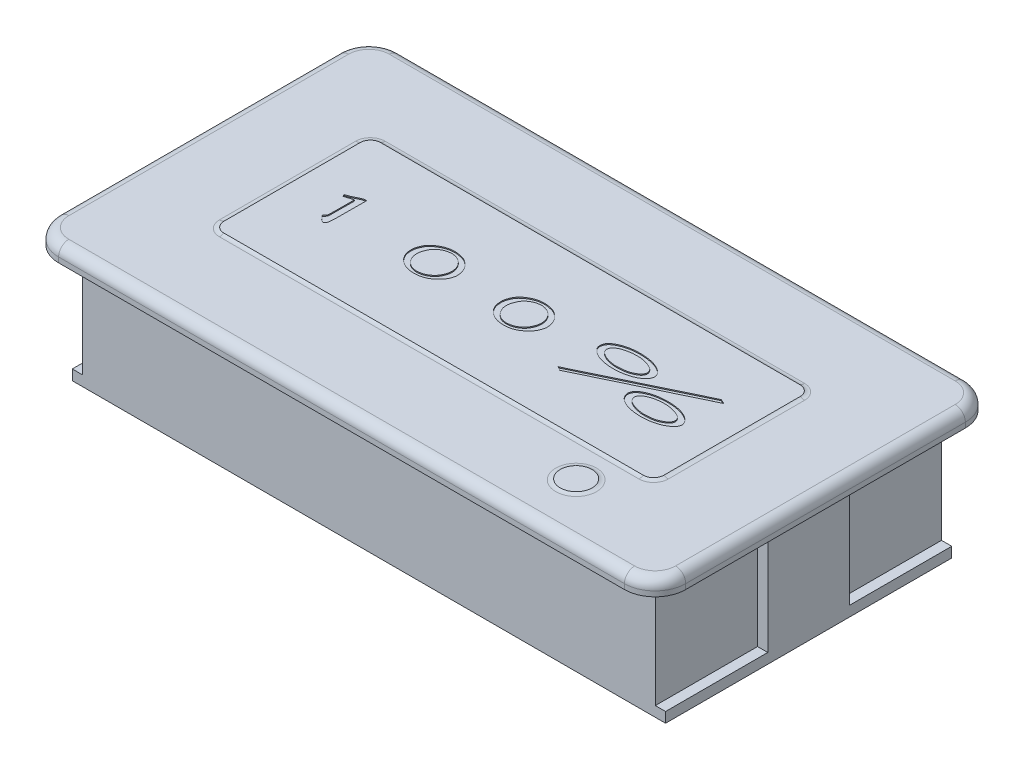
from build123d import *

# Parameters (mm, degrees)
SKETCH_1_W          = 61.36
SKETCH_1_H          = 33.36
EXTRUDE_1_DEPTH     = 1.5
SKETCH_2_W          = 58.05
SKETCH_2_H          = 28
EXTRUDE_2_DEPTH     = 12
CUT_EXTRUDE_1_REACH = 47.017
SKETCH_3_W          = 1
SKETCH_3_H          = 11
SKETCH_6_W          = 8
SKETCH_6_H          = 3
CUT_EXTRUDE_2_DEPTH = 0.1
SKETCH_8_R          = 1.561705839
SKETCH_8_W          = 43.044921596
SKETCH_8_H          = 15.335355584
EXTRUDE_5_DEPTH     = 0.1
FILLET_1_R          = 3
FILLET_2_R          = 1
FILLET_3_R          = 1
CUT_EXTRUDE_3_DEPTH = 0.1
SKETCH_10_R         = 0.5
EXTRUDE_6_DEPTH     = 0.1
SKETCH_5_W          = 1
SKETCH_5_H          = 11
EXTRUDE_4_DEPTH     = 4


with BuildPart() as part:
    # 草图1 → 凸台-拉伸1 (new body)
    with BuildSketch(Plane(origin=(0, 0, 0), x_dir=(1, 0, 0), z_dir=(0, 1, 0))):
        Rectangle(SKETCH_1_W, SKETCH_1_H)
    extrude(amount=EXTRUDE_1_DEPTH)

    # 草图2 → 凸台-拉伸2 (add)
    with BuildSketch(Plane.XZ):
        Rectangle(SKETCH_2_W, SKETCH_2_H)
    extrude(amount=EXTRUDE_2_DEPTH)

    # 草图3 → 切除-拉伸1 (cut, up to next)
    with BuildSketch(Plane.XY.offset(14), mode=Mode.PRIVATE) as cut_extrude_1_sk1:
        with Locations((-28.525, -5.5)):
            Rectangle(SKETCH_3_W, SKETCH_3_H)
    cut_extrude_1_tool1 = extrude(cut_extrude_1_sk1.sketch, amount=-CUT_EXTRUDE_1_REACH, mode=Mode.PRIVATE) & part.part
    # 草图3 → 切除-拉伸1 (cut, up to next)
    with BuildSketch(Plane.XY.offset(14), mode=Mode.PRIVATE) as cut_extrude_1_sk2:
        with Locations((28.525, -5.5)):
            Rectangle(SKETCH_3_W, SKETCH_3_H)
    cut_extrude_1_tool2 = extrude(cut_extrude_1_sk2.sketch, amount=-CUT_EXTRUDE_1_REACH, mode=Mode.PRIVATE) & part.part
    add(cut_extrude_1_tool1.solids().sort_by_distance((-28.525, -5.5, 14))[0], mode=Mode.SUBTRACT)
    add(cut_extrude_1_tool2.solids().sort_by_distance((28.525, -5.5, 14))[0], mode=Mode.SUBTRACT)

    # 草图6 → 切除-拉伸2 (cut)
    with BuildSketch(Plane.XZ.offset(12)):
        with Locations((-20.025, 10.5)):
            Rectangle(SKETCH_6_W, SKETCH_6_H)
    extrude(amount=-CUT_EXTRUDE_2_DEPTH, mode=Mode.SUBTRACT)

    # 草图8 → 凸台-拉伸5 (add)
    with BuildSketch(Plane(origin=(0, 1.5, 0), x_dir=(1, 0, 0), z_dir=(0, 1, 0))):
        with Locations(Location((17.525272803, -11.248179316, 0), (0, 0, 270))):
            Circle(SKETCH_8_R)
        Rectangle(SKETCH_8_W, SKETCH_8_H)
    extrude(amount=EXTRUDE_5_DEPTH)

    # 圆角1
    fillet_1_edges = [part.edges().sort_by_distance(p)[0] for p in [
        (-30.68, 0.75, -16.68),
        (30.68, 0.75, -16.68),
        (30.68, 0.75, 16.68),
        (-30.68, 0.75, 16.68),
    ]]
    fillet(fillet_1_edges, radius=FILLET_1_R)

    # 圆角2
    fillet_2_edges = [part.edges().sort_by_distance(p)[0] for p in [
        (-21.522460798, 1.55, -7.667677792),
        (-21.522460798, 1.55, 7.667677792),
        (21.522460798, 1.55, 7.667677792),
        (21.522460798, 1.55, -7.667677792),
    ]]
    fillet(fillet_2_edges, radius=FILLET_2_R)

    # 圆角3
    # the kernel refuses this fillet: 1 mm, written as the material it adds along each edge
    with BuildSketch(Plane(origin=(20.522460798, 1.5, 6.667677792), x_dir=(0, 0, 1), z_dir=(-1, 0, 0))) as fillet_3_piece_1:
        with BuildLine():
            CenterArc((1.435889894, 1), FILLET_3_R, 244.158067237, 25.841932763)
            Line((1, 0.1), (1, 0))
            Line((1, 0), (1.435889894, 0))
        make_face()
    revolve(axis=Axis((20.522460798, 1.5, 6.667677792), (0, 1, 0)), revolution_arc=90)
    with BuildSketch(Plane(origin=(21.522460798, 1.5, -6.667677792), x_dir=(1, 0, 0), z_dir=(0, 0, 1)), Plane(origin=(-21.522460798, 1.5, 6.667677792), x_dir=(-1, 0, 0), z_dir=(0, 0, -1))) as fillet_3_piece_2:
        with BuildLine():
            CenterArc((0.435889894, 1), FILLET_3_R, 244.158067237, 25.841932763)
            Line((0, 0.1), (0, 0))
            Line((0, 0), (0.435889894, 0))
        make_face()
    extrude(amount=13.335355584)
    with BuildSketch(Plane(origin=(20.522460798, 1.5, -6.667677792), x_dir=(0, 0, -1), z_dir=(-1, 0, 0))) as fillet_3_piece_3:
        with BuildLine():
            CenterArc((1.435889894, -1), FILLET_3_R, 90, 25.841932763)
            Line((1, -0.1), (1, 0))
            Line((1, 0), (1.435889894, 0))
        make_face()
    revolve(axis=Axis((20.522460798, 1.5, -6.667677792), (0, -1, 0)), revolution_arc=90)
    with BuildSketch(Plane(origin=(-20.522460798, 1.5, -7.667677792), x_dir=(0, 0, -1), z_dir=(1, 0, 0)), Plane(origin=(20.522460798, 1.5, 7.667677792), x_dir=(0, 0, 1), z_dir=(-1, 0, 0))) as fillet_3_piece_4:
        with BuildLine():
            CenterArc((0.435889894, 1), FILLET_3_R, 244.158067237, 25.841932763)
            Line((0, 0.1), (0, 0))
            Line((0, 0), (0.435889894, 0))
        make_face()
    extrude(amount=41.044921596)
    with BuildSketch(Plane(origin=(-20.522460798, 1.5, -6.667677792), x_dir=(-1, 0, 0), z_dir=(0, 0, 1))) as fillet_3_piece_5:
        with BuildLine():
            CenterArc((1.435889894, -1), FILLET_3_R, 90, 25.841932763)
            Line((1, -0.1), (1, 0))
            Line((1, 0), (1.435889894, 0))
        make_face()
    revolve(axis=Axis((-20.522460798, 1.5, -6.667677792), (0, -1, 0)), revolution_arc=90)
    with BuildSketch(Plane(origin=(-20.522460798, 1.5, 6.667677792), x_dir=(0, 0, 1), z_dir=(1, 0, 0))) as fillet_3_piece_6:
        with BuildLine():
            CenterArc((1.435889894, -1), FILLET_3_R, 90, 25.841932763)
            Line((1, -0.1), (1, 0))
            Line((1, 0), (1.435889894, 0))
        make_face()
    revolve(axis=Axis((-20.522460798, 1.5, 6.667677792), (0, -1, 0)), revolution_arc=90)
    with BuildSketch(Plane(origin=(17.525272803, 1.5, 11.248179316), x_dir=(0, 0, 1), z_dir=(-1, 0, 0))) as fillet_3_piece_7:
        with BuildLine():
            CenterArc((1.997595733, 1), FILLET_3_R, 244.158067237, 25.841932763)
            Line((1.561705839, 0.1), (1.561705839, 0))
            Line((1.561705839, 0), (1.997595733, 0))
        make_face()
    revolve(axis=Axis((17.525272803, 1.5, 11.248179316), (0, 1, 0)))
    # the kernel refuses this fillet: 1 mm, written as the material it takes off along each edge
    with BuildSketch(Plane(origin=(-27.68, 1.5, -13.68), x_dir=(-1, 0, 0), z_dir=(0, 0, 1))) as fillet_3_2_piece_1:
        with BuildLine():
            CenterArc((3 - FILLET_3_R, FILLET_3_R), FILLET_3_R, 270, 90)
            Line((3, FILLET_3_R), (3, 0))
            Line((3, 0), (3 - FILLET_3_R, 0))
        make_face()
    revolve(axis=Axis((-27.68, 1.5, -13.68), (0, -1, 0)), revolution_arc=90, mode=Mode.SUBTRACT)
    with BuildSketch(Plane(origin=(-27.68, 1.5, -16.68), x_dir=(0, 0, 1), z_dir=(1, 0, 0)), Plane(origin=(27.68, 1.5, 16.68), x_dir=(0, 0, -1), z_dir=(-1, 0, 0))) as fillet_3_2_piece_2:
        with BuildLine():
            CenterArc((FILLET_3_R, FILLET_3_R), FILLET_3_R, 180, 90)
            Line((0, FILLET_3_R), (0, 0))
            Line((0, 0), (FILLET_3_R, 0))
        make_face()
    extrude(amount=55.36, mode=Mode.SUBTRACT)
    with BuildSketch(Plane(origin=(27.68, 1.5, -13.68), x_dir=(1, 0, 0), z_dir=(0, 0, 1))) as fillet_3_2_piece_3:
        with BuildLine():
            CenterArc((3 - FILLET_3_R, -FILLET_3_R), FILLET_3_R, 0, 90)
            Line((3, -FILLET_3_R), (3, 0))
            Line((3, 0), (3 - FILLET_3_R, 0))
        make_face()
    revolve(axis=Axis((27.68, 1.5, -13.68), (0, 1, 0)), revolution_arc=90, mode=Mode.SUBTRACT)
    with BuildSketch(Plane(origin=(30.68, 1.5, -13.68), x_dir=(-1, 0, 0), z_dir=(0, 0, 1)), Plane(origin=(-30.68, 1.5, 13.68), x_dir=(1, 0, 0), z_dir=(0, 0, -1))) as fillet_3_2_piece_4:
        with BuildLine():
            CenterArc((FILLET_3_R, FILLET_3_R), FILLET_3_R, 180, 90)
            Line((0, FILLET_3_R), (0, 0))
            Line((0, 0), (FILLET_3_R, 0))
        make_face()
    extrude(amount=27.36, mode=Mode.SUBTRACT)
    with BuildSketch(Plane(origin=(27.68, 1.5, 13.68), x_dir=(0, 0, 1), z_dir=(-1, 0, 0))) as fillet_3_2_piece_5:
        with BuildLine():
            CenterArc((3 - FILLET_3_R, -FILLET_3_R), FILLET_3_R, 0, 90)
            Line((3, -FILLET_3_R), (3, 0))
            Line((3, 0), (3 - FILLET_3_R, 0))
        make_face()
    revolve(axis=Axis((27.68, 1.5, 13.68), (0, 1, 0)), revolution_arc=90, mode=Mode.SUBTRACT)
    with BuildSketch(Plane(origin=(-27.68, 1.5, 13.68), x_dir=(0, 0, 1), z_dir=(1, 0, 0))) as fillet_3_2_piece_6:
        with BuildLine():
            CenterArc((3 - FILLET_3_R, FILLET_3_R), FILLET_3_R, 270, 90)
            Line((3, FILLET_3_R), (3, 0))
            Line((3, 0), (3 - FILLET_3_R, 0))
        make_face()
    revolve(axis=Axis((-27.68, 1.5, 13.68), (0, -1, 0)), revolution_arc=90, mode=Mode.SUBTRACT)

    # 草图9 → 切除-拉伸3 (cut)
    # profile 1 of 6: a face of its own
    with BuildSketch(Plane(origin=(0, 1.6, 0), x_dir=(1, 0, 0), z_dir=(0, 1, 0))):
        with BuildLine():
            Line((-16.522305337, 2.04982507), (-16.278005857, 2.077845082))
            Line((-16.278005857, 2.077845082), (-16.295518364, -1.020993128))
            add(Edge.make_bspline(
                [(-16.295518364, -1.020993128), (-16.29694041, -1.052517439), (-16.29963999, -1.112362505), (-16.304075821, -1.197880181), (-16.308384257, -1.274648769), (-16.312747498, -1.342950587), (-16.317011922, -1.402213625), (-16.321434023, -1.452710411), (-16.325674854, -1.494469232), (-16.334037704, -1.560231768), (-16.357379973, -1.655919386), (-16.391977046, -1.760161813), (-16.437180737, -1.840070294), (-16.493518355, -1.880949742), (-16.564478291, -1.901487995), (-16.615587949, -1.898324159), (-16.643141639, -1.896618506)],
                knots=[0, 0, 0, 0, 1.253270449, 2.379181433, 3.400917398, 4.306944487, 5.097324398, 5.760602192, 6.320025896, 6.764316387, 8.392561048, 10.218797506, 11.125639935, 11.97880986, 12.910357651, 14, 14, 14, 14], degree=3))
            add(Edge.make_bspline(
                [(-16.643141639, -1.896618506), (-16.644310129, -1.896330377), (-16.64870988, -1.895245479), (-16.658582245, -1.892426592), (-16.674967288, -1.888176091), (-16.705992852, -1.880509313), (-16.749773069, -1.860721411), (-16.776820819, -1.832080494), (-16.791122328, -1.816936596)],
                knots=[0, 0, 0, 0, 0.126258631, 0.475405613, 1.0770367, 1.901565101, 3.832950775, 6, 6, 6, 6], degree=3))
            Line((-16.791122328, -1.816936596), (-16.872555488, -1.74425969))
            Line((-16.872555488, -1.74425969), (-17.064317446, -1.533233974))
            add(Edge.make_bspline(
                [(-17.064317446, -1.533233974), (-17.077546765, -1.519601763), (-17.10229149, -1.494103451), (-17.135458436, -1.457232954), (-17.163159985, -1.425389386), (-17.182953382, -1.396492648), (-17.199567176, -1.373688666), (-17.208651575, -1.353985237), (-17.213037604, -1.337700687), (-17.203646567, -1.314165557), (-17.176473622, -1.288950612), (-17.141160488, -1.251308257), (-17.099935265, -1.211376664), (-17.060920712, -1.163758839), (-17.024866908, -1.113955426), (-16.996751892, -1.059862421), (-16.976204755, -0.998705059), (-16.968303048, -0.938326854), (-16.96409758, -0.879191788), (-16.961313097, -0.82254669), (-16.961076321, -0.755384535), (-16.960453804, -0.707226405), (-16.960118026, -0.681250482)],
                knots=[0, 0, 0, 0, 1.159192629, 2.168207027, 3.028127215, 3.730173768, 4.308262321, 4.738775655, 5.063864675, 5.289205653, 6.238082505, 7.283704709, 8.45528819, 9.73262076, 11.037362537, 12.200654645, 13.440030025, 14.954285351, 15.901153286, 17.060345915, 18.414385521, 20, 20, 20, 20], degree=3))
            Line((-16.960118026, -0.681250482), (-16.942605518, 1.536708599))
            Line((-16.942605518, 1.536708599), (-17.797215886, 1.274896611))
            Line((-17.797215886, 1.274896611), (-17.900539681, 1.457902315))
            add(Edge.make_bspline(
                [(-17.900539681, 1.457902315), (-17.860535442, 1.473034217), (-17.78336935, 1.502222867), (-17.672768707, 1.544895091), (-17.571870932, 1.584530674), (-17.480585635, 1.620175418), (-17.398931455, 1.653640746), (-17.326814563, 1.683953197), (-17.264410694, 1.711241173), (-17.160022952, 1.758032752), (-17.00976662, 1.832929545), (-16.879600057, 1.904589605), (-16.813012962, 1.941247523)],
                knots=[0, 0, 0, 0, 1.076823803, 2.077136992, 2.984608936, 3.806096834, 4.544355276, 5.206290949, 5.77559763, 6.259092731, 8.086327693, 10, 10, 10, 10], degree=3))
            Line((-16.813012962, 1.941247523), (-16.537190968, 2.045446943))
            Line((-16.537190968, 2.045446943), (-16.522305337, 2.04982507))
        make_face()
    # profile 2 of 6: a face of its own
    with BuildSketch(Plane(origin=(0, 1.6, 0), x_dir=(1, 0, 0), z_dir=(0, 1, 0))):
        with BuildLine():
            add(Edge.make_bspline(
                [(-9.946008503, 0.217141155), (-9.93814979, 0.274284489), (-9.921853486, 0.392780372), (-9.872565759, 0.572793753), (-9.804495018, 0.760965555), (-9.733972285, 0.921824268), (-9.666465664, 1.051878332), (-9.604191043, 1.146900063), (-9.534118965, 1.238647777), (-9.456267266, 1.327601742), (-9.368645206, 1.411399982), (-9.274138711, 1.493288235), (-9.170448865, 1.571188671), (-9.05970556, 1.644306183), (-8.946222973, 1.711959765), (-8.835621694, 1.775656145), (-8.727339239, 1.830475228), (-8.623193933, 1.880157755), (-8.521716135, 1.922078976), (-8.423575741, 1.957285346), (-8.328924755, 1.985672556), (-8.208308076, 2.012858602), (-8.063117878, 2.037425577), (-7.89457868, 2.058843671), (-7.733489018, 2.070985514), (-7.628538173, 2.0708877), (-7.577441857, 2.070840079)],
                knots=[0, 0, 0, 0, 1.254515551, 2.601439504, 4.052433186, 5.608449262, 6.42134114, 7.239060577, 8.077763398, 8.933075807, 9.809254552, 10.714796857, 11.653866356, 12.63011514, 13.602074704, 14.529638956, 15.407681693, 16.243298377, 17.040925322, 17.79655296, 18.512231994, 19.190375642, 20.486671252, 21.716061122, 22.888042678, 24, 24, 24, 24], degree=3))
            add(Edge.make_bspline(
                [(-7.577441857, 2.070840079), (-7.526605438, 2.06761165), (-7.421706275, 2.0609499), (-7.260596316, 2.039484296), (-7.09132992, 2.007167209), (-6.915906333, 1.967574333), (-6.740474671, 1.915233063), (-6.573214799, 1.843687704), (-6.416140384, 1.756000594), (-6.272349437, 1.651198449), (-6.14029858, 1.539393943), (-6.020394422, 1.425331468), (-5.914682482, 1.309944612), (-5.823738484, 1.191311809), (-5.744134881, 1.06919672), (-5.67794438, 0.939744157), (-5.621444476, 0.803753027), (-5.577344166, 0.661357668), (-5.544448385, 0.516475524), (-5.517645226, 0.372077335), (-5.504166428, 0.228783787), (-5.501685145, 0.133686571), (-5.500458462, 0.086672974)],
                knots=[0, 0, 0, 0, 0.953788111, 1.968108232, 3.041301502, 4.180314873, 5.335349277, 6.464389544, 7.580426586, 8.696905307, 9.790849521, 10.819270693, 11.794420408, 12.718290759, 13.615914081, 14.520500969, 15.437163111, 16.370765878, 17.308201447, 18.21858344, 19.119313855, 20, 20, 20, 20], degree=3))
            add(Edge.make_bspline(
                [(-5.500458462, 0.086672974), (-5.506974277, 0.0483369), (-5.520289402, -0.030003198), (-5.550086524, -0.148130652), (-5.585823037, -0.270500374), (-5.630374589, -0.396601969), (-5.685931575, -0.527050662), (-5.76069511, -0.657846716), (-5.850235186, -0.791758416), (-5.95708489, -0.925325077), (-6.077517821, -1.058295048), (-6.214885491, -1.184254879), (-6.364275809, -1.306593656), (-6.527460778, -1.419598865), (-6.698855053, -1.522570474), (-6.87866159, -1.605818911), (-7.063277859, -1.671388487), (-7.251219621, -1.716297508), (-7.436078535, -1.747134302), (-7.613535283, -1.766994658), (-7.781307538, -1.779076701), (-7.890024947, -1.776855773), (-7.94257764, -1.775782204)],
                knots=[0, 0, 0, 0, 0.693567351, 1.417310842, 2.172018723, 2.9675753, 3.802519327, 4.697825103, 5.651110217, 6.674267052, 7.746920624, 8.848709664, 9.996326313, 11.189624248, 12.387323168, 13.559247832, 14.718783999, 15.877021346, 17.001999769, 18.060758541, 19.062593923, 20, 20, 20, 20], degree=3))
            add(Edge.make_bspline(
                [(-7.94257764, -1.775782204), (-7.99051375, -1.773964685), (-8.089963576, -1.770194002), (-8.242936165, -1.748122315), (-8.40537584, -1.718939345), (-8.5746364, -1.677637579), (-8.746215737, -1.621491775), (-8.915148468, -1.548156721), (-9.077412061, -1.454969812), (-9.23297447, -1.347535266), (-9.377410583, -1.226658991), (-9.50687634, -1.096199536), (-9.621472082, -0.958741916), (-9.717479005, -0.814300102), (-9.796552051, -0.668742935), (-9.857886883, -0.526452517), (-9.900233798, -0.388753243), (-9.922251848, -0.255465319), (-9.931942176, -0.128521372), (-9.94043468, -0.007988853), (-9.944670162, 0.106490169), (-9.945570719, 0.180946203), (-9.946008503, 0.217141155)],
                knots=[0, 0, 0, 0, 0.905667355, 1.878927178, 2.916113879, 4.023452927, 5.16732576, 6.322913841, 7.495868378, 8.696580582, 9.89043616, 11.048455469, 12.16465534, 13.265771476, 14.319304284, 15.290233916, 16.188620489, 17.033496907, 17.836243281, 18.593298513, 19.316166999, 20, 20, 20, 20], degree=3))
        make_face()
        with BuildLine():
            add(Edge.make_bspline(
                [(-9.33482199, 0.192623645), (-9.336853692, 0.165494856), (-9.341174595, 0.107798952), (-9.341997306, 0.015370775), (-9.335675863, -0.087677224), (-9.327403895, -0.200166619), (-9.308951871, -0.318775297), (-9.274979838, -0.438908692), (-9.228247779, -0.559340595), (-9.168713672, -0.678888863), (-9.097329344, -0.795571186), (-9.014461599, -0.907301904), (-8.921179375, -1.01314091), (-8.81997267, -1.113404366), (-8.711151214, -1.203067897), (-8.596101231, -1.278006827), (-8.477750733, -1.339597392), (-8.355176718, -1.383034741), (-8.234726498, -1.414649782), (-8.119214776, -1.437727444), (-8.009793811, -1.452501136), (-7.938532658, -1.454979626), (-7.904050123, -1.456178941)],
                knots=[0, 0, 0, 0, 0.664039602, 1.412240222, 2.254123296, 3.183735048, 4.165386184, 5.1784212, 6.225102978, 7.314916093, 8.434306671, 9.560141952, 10.706356806, 11.875312884, 13.034915157, 14.141647827, 15.221938858, 16.283623018, 17.308541476, 18.260175532, 19.158116925, 20, 20, 20, 20], degree=3))
            add(Edge.make_bspline(
                [(-7.904050123, -1.456178941), (-7.869883566, -1.456071333), (-7.798205919, -1.455845583), (-7.685551259, -1.445577591), (-7.562969676, -1.426452822), (-7.430881137, -1.401322977), (-7.293274056, -1.3638224), (-7.155483404, -1.308590611), (-7.017997933, -1.238955604), (-6.884058951, -1.155000782), (-6.757422565, -1.062419286), (-6.644106849, -0.964263348), (-6.545475255, -0.863177223), (-6.462931988, -0.757310113), (-6.39285333, -0.647809512), (-6.329394134, -0.537585044), (-6.276030701, -0.423262835), (-6.229804969, -0.308166868), (-6.192665734, -0.192961128), (-6.162772551, -0.081680588), (-6.141129483, 0.025311963), (-6.128723757, 0.129839999), (-6.124025667, 0.236702623), (-6.129221118, 0.349608402), (-6.141147473, 0.471040887), (-6.155731355, 0.554046012), (-6.163306873, 0.597162569)],
                knots=[0, 0, 0, 0, 0.796315816, 1.670582245, 2.633958042, 3.688291156, 4.804414464, 5.953110511, 7.143073555, 8.393162038, 9.634477078, 10.797038444, 11.884709299, 12.922038782, 13.920538545, 14.914016718, 15.885077141, 16.859375076, 17.804111584, 18.70537311, 19.544834175, 20.346713433, 21.157237687, 22.035757835, 22.979685189, 24, 24, 24, 24], degree=3))
            add(Edge.make_bspline(
                [(-6.163306873, 0.597162569), (-6.174578836, 0.638249654), (-6.196585587, 0.718465782), (-6.2405171, 0.832350653), (-6.288053909, 0.939191776), (-6.344080336, 1.038330512), (-6.408593171, 1.133367739), (-6.483613012, 1.22562003), (-6.570768375, 1.316084628), (-6.666179873, 1.405713021), (-6.771854551, 1.488592665), (-6.886796779, 1.559819787), (-7.00849922, 1.620003707), (-7.13617532, 1.664724987), (-7.2623368, 1.699603184), (-7.381638857, 1.727451306), (-7.492929259, 1.744666597), (-7.564260055, 1.7491077), (-7.598456866, 1.751236816)],
                knots=[0, 0, 0, 0, 1.032713607, 2.016212303, 2.957132945, 3.866830179, 4.773962121, 5.740265773, 6.746732151, 7.818710245, 8.913333296, 9.997652484, 11.093099316, 12.19931275, 13.272855827, 14.267224483, 15.169287294, 16, 16, 16, 16], degree=3))
            add(Edge.make_bspline(
                [(-7.598456866, 1.751236816), (-7.633802776, 1.75057827), (-7.707292196, 1.749209055), (-7.821237431, 1.736788544), (-7.9433941, 1.718333672), (-8.073974801, 1.692593757), (-8.213275, 1.654352196), (-8.357172444, 1.590461941), (-8.509129847, 1.509188299), (-8.636567883, 1.424763017), (-8.73899657, 1.348878697), (-8.81172595, 1.285218631), (-8.880304753, 1.21832198), (-8.942529414, 1.14571333), (-9.000266819, 1.069779441), (-9.053364957, 0.989590355), (-9.100596005, 0.904603472), (-9.154571396, 0.787740955), (-9.212298699, 0.645532318), (-9.269088807, 0.483234925), (-9.31073282, 0.334119473), (-9.327093268, 0.238020889), (-9.33482199, 0.192623645)],
                knots=[0, 0, 0, 0, 0.827660369, 1.720829398, 2.681877364, 3.720947843, 4.837486309, 6.056520426, 7.399283751, 8.870690157, 9.632270116, 10.383438355, 11.132737703, 11.874262335, 12.620812181, 13.365983471, 14.124950798, 14.895620383, 16.379693499, 17.71797672, 18.921965695, 20, 20, 20, 20], degree=3))
        make_face(mode=Mode.SUBTRACT)
    # profile 3 of 6: a face of its own
    with BuildSketch(Plane(origin=(0, 1.6, 0), x_dir=(1, 0, 0), z_dir=(0, 1, 0))):
        with BuildLine():
            add(Edge.make_bspline(
                [(-1.170140721, 0.217141155), (-1.162282008, 0.274284489), (-1.145985705, 0.392780372), (-1.096697978, 0.572793753), (-1.028627236, 0.760965555), (-0.958104503, 0.921824268), (-0.890597882, 1.051878332), (-0.828323261, 1.146900063), (-0.758251183, 1.238647777), (-0.680399484, 1.327601742), (-0.592777424, 1.411399982), (-0.498270929, 1.493288235), (-0.394581083, 1.571188671), (-0.283837778, 1.644306183), (-0.170355191, 1.711959765), (-0.059753912, 1.775656145), (0.048528543, 1.830475228), (0.152673849, 1.880157755), (0.254151647, 1.922078976), (0.352292041, 1.957285346), (0.446943027, 1.985672556), (0.567559706, 2.012858602), (0.712749904, 2.037425577), (0.881289102, 2.058843671), (1.042378764, 2.070985514), (1.147329609, 2.0708877), (1.198425924, 2.070840079)],
                knots=[0, 0, 0, 0, 1.254515551, 2.601439504, 4.052433186, 5.608449262, 6.42134114, 7.239060577, 8.077763398, 8.933075807, 9.809254552, 10.714796857, 11.653866356, 12.63011514, 13.602074704, 14.529638956, 15.407681693, 16.243298377, 17.040925322, 17.79655296, 18.512231994, 19.190375642, 20.486671252, 21.716061122, 22.888042678, 24, 24, 24, 24], degree=3))
            add(Edge.make_bspline(
                [(1.198425924, 2.070840079), (1.249262344, 2.06761165), (1.354161507, 2.0609499), (1.515271466, 2.039484296), (1.684537862, 2.007167209), (1.859961449, 1.967574333), (2.03539311, 1.915233063), (2.202652982, 1.843687704), (2.359727397, 1.756000594), (2.503518345, 1.651198449), (2.635569202, 1.539393943), (2.75547336, 1.425331468), (2.8611853, 1.309944612), (2.952129298, 1.191311809), (3.031732901, 1.06919672), (3.097923402, 0.939744157), (3.154423306, 0.803753027), (3.198523616, 0.661357668), (3.231419397, 0.516475524), (3.258222556, 0.372077335), (3.271701354, 0.228783787), (3.274182637, 0.133686571), (3.275409319, 0.086672974)],
                knots=[0, 0, 0, 0, 0.953788111, 1.968108232, 3.041301502, 4.180314873, 5.335349277, 6.464389544, 7.580426586, 8.696905307, 9.790849521, 10.819270693, 11.794420408, 12.718290759, 13.615914081, 14.520500969, 15.437163111, 16.370765878, 17.308201447, 18.21858344, 19.119313855, 20, 20, 20, 20], degree=3))
            add(Edge.make_bspline(
                [(3.275409319, 0.086672974), (3.268893504, 0.0483369), (3.25557838, -0.030003198), (3.225781258, -0.148130652), (3.190044744, -0.270500374), (3.145493193, -0.396601969), (3.089936207, -0.527050662), (3.015172672, -0.657846716), (2.925632596, -0.791758416), (2.818782892, -0.925325077), (2.698349961, -1.058295048), (2.560982291, -1.184254879), (2.411591973, -1.306593656), (2.248407004, -1.419598865), (2.077012729, -1.522570474), (1.897206192, -1.605818911), (1.712589922, -1.671388487), (1.524648161, -1.716297508), (1.339789247, -1.747134302), (1.162332499, -1.766994658), (0.994560244, -1.779076701), (0.885842835, -1.776855773), (0.833290142, -1.775782204)],
                knots=[0, 0, 0, 0, 0.693567351, 1.417310842, 2.172018723, 2.9675753, 3.802519327, 4.697825103, 5.651110217, 6.674267052, 7.746920624, 8.848709664, 9.996326313, 11.189624248, 12.387323168, 13.559247832, 14.718783999, 15.877021346, 17.001999769, 18.060758541, 19.062593923, 20, 20, 20, 20], degree=3))
            add(Edge.make_bspline(
                [(0.833290142, -1.775782204), (0.785354032, -1.773964685), (0.685904206, -1.770194002), (0.532931617, -1.748122315), (0.370491942, -1.718939345), (0.201231382, -1.677637579), (0.029652045, -1.621491775), (-0.139280687, -1.548156721), (-0.30154428, -1.454969812), (-0.457106688, -1.347535266), (-0.601542801, -1.226658991), (-0.731008558, -1.096199536), (-0.8456043, -0.958741916), (-0.941611224, -0.814300102), (-1.020684269, -0.668742935), (-1.082019102, -0.526452517), (-1.124366016, -0.388753243), (-1.146384067, -0.255465319), (-1.156074394, -0.128521372), (-1.164566898, -0.007988853), (-1.16880238, 0.106490169), (-1.169702938, 0.180946203), (-1.170140721, 0.217141155)],
                knots=[0, 0, 0, 0, 0.905667355, 1.878927178, 2.916113879, 4.023452927, 5.16732576, 6.322913841, 7.495868378, 8.696580582, 9.89043616, 11.048455469, 12.16465534, 13.265771476, 14.319304284, 15.290233916, 16.188620489, 17.033496907, 17.836243281, 18.593298513, 19.316166999, 20, 20, 20, 20], degree=3))
        make_face()
        with BuildLine():
            add(Edge.make_bspline(
                [(-0.558954208, 0.192623645), (-0.56098591, 0.165494856), (-0.565306813, 0.107798952), (-0.566129524, 0.015370775), (-0.559808082, -0.087677224), (-0.551536113, -0.200166619), (-0.533084089, -0.318775297), (-0.499112056, -0.438908692), (-0.452379997, -0.559340595), (-0.39284589, -0.678888863), (-0.321461562, -0.795571186), (-0.238593817, -0.907301904), (-0.145311593, -1.01314091), (-0.044104888, -1.113404366), (0.064716568, -1.203067897), (0.17976655, -1.278006827), (0.298117049, -1.339597392), (0.420691064, -1.383034741), (0.541141284, -1.414649782), (0.656653005, -1.437727444), (0.76607397, -1.452501136), (0.837335123, -1.454979626), (0.871817659, -1.456178941)],
                knots=[0, 0, 0, 0, 0.664039602, 1.412240222, 2.254123296, 3.183735048, 4.165386184, 5.1784212, 6.225102978, 7.314916093, 8.434306671, 9.560141952, 10.706356806, 11.875312884, 13.034915157, 14.141647827, 15.221938858, 16.283623018, 17.308541476, 18.260175532, 19.158116925, 20, 20, 20, 20], degree=3))
            add(Edge.make_bspline(
                [(0.871817659, -1.456178941), (0.905984216, -1.456071333), (0.977661863, -1.455845583), (1.090316523, -1.445577591), (1.212898106, -1.426452822), (1.344986645, -1.401322977), (1.482593726, -1.3638224), (1.620384377, -1.308590611), (1.757869849, -1.238955604), (1.891808831, -1.155000782), (2.018445216, -1.062419286), (2.131760933, -0.964263348), (2.230392527, -0.863177223), (2.312935794, -0.757310113), (2.383014452, -0.647809512), (2.446473648, -0.537585044), (2.499837081, -0.423262835), (2.546062812, -0.308166868), (2.583202048, -0.192961128), (2.613095231, -0.081680588), (2.634738299, 0.025311963), (2.647144025, 0.129839999), (2.651842115, 0.236702623), (2.646646664, 0.349608402), (2.634720308, 0.471040887), (2.620136426, 0.554046012), (2.612560909, 0.597162569)],
                knots=[0, 0, 0, 0, 0.796315816, 1.670582245, 2.633958042, 3.688291156, 4.804414464, 5.953110511, 7.143073555, 8.393162038, 9.634477078, 10.797038444, 11.884709299, 12.922038782, 13.920538545, 14.914016718, 15.885077141, 16.859375076, 17.804111584, 18.70537311, 19.544834175, 20.346713433, 21.157237687, 22.035757835, 22.979685189, 24, 24, 24, 24], degree=3))
            add(Edge.make_bspline(
                [(2.612560909, 0.597162569), (2.601288946, 0.638249654), (2.579282195, 0.718465782), (2.535350681, 0.832350653), (2.487813873, 0.939191776), (2.431787445, 1.038330512), (2.367274611, 1.133367739), (2.29225477, 1.22562003), (2.205099407, 1.316084628), (2.109687909, 1.405713021), (2.00401323, 1.488592665), (1.889071003, 1.559819787), (1.767368562, 1.620003707), (1.639692462, 1.664724987), (1.513530982, 1.699603184), (1.394228925, 1.727451306), (1.282938523, 1.744666597), (1.211607727, 1.7491077), (1.177410915, 1.751236816)],
                knots=[0, 0, 0, 0, 1.032713607, 2.016212303, 2.957132945, 3.866830179, 4.773962121, 5.740265773, 6.746732151, 7.818710245, 8.913333296, 9.997652484, 11.093099316, 12.19931275, 13.272855827, 14.267224483, 15.169287294, 16, 16, 16, 16], degree=3))
            add(Edge.make_bspline(
                [(1.177410915, 1.751236816), (1.142065006, 1.75057827), (1.068575586, 1.749209055), (0.954630351, 1.736788544), (0.832473681, 1.718333672), (0.701892981, 1.692593757), (0.562592782, 1.654352196), (0.418695337, 1.590461941), (0.266737935, 1.509188299), (0.139299898, 1.424763017), (0.036871212, 1.348878697), (-0.035858169, 1.285218631), (-0.104436971, 1.21832198), (-0.166661632, 1.14571333), (-0.224399037, 1.069779441), (-0.277497175, 0.989590355), (-0.324728223, 0.904603472), (-0.378703614, 0.787740955), (-0.436430917, 0.645532318), (-0.493221025, 0.483234925), (-0.534865038, 0.334119473), (-0.551225486, 0.238020889), (-0.558954208, 0.192623645)],
                knots=[0, 0, 0, 0, 0.827660369, 1.720829398, 2.681877364, 3.720947843, 4.837486309, 6.056520426, 7.399283751, 8.870690157, 9.632270116, 10.383438355, 11.132737703, 11.874262335, 12.620812181, 13.365983471, 14.124950798, 14.895620383, 16.379693499, 17.71797672, 18.921965695, 20, 20, 20, 20], degree=3))
        make_face(mode=Mode.SUBTRACT)
    # profile 4 of 6: a face of its own
    with BuildSketch(Plane(origin=(0, 1.6, 0), x_dir=(1, 0, 0), z_dir=(0, 1, 0))):
        Polygon((17.918842755, 2.553309662), (18.382048579, 2.349288949), (7.533050154, -2.866811424), (7.160909369, -2.640024451), align=None)
    # profile 5 of 6: a face of its own
    with BuildSketch(Plane(origin=(0, 1.6, 0), x_dir=(1, 0, 0), z_dir=(0, 1, 0))):
        with BuildLine():
            add(Edge.make_bspline(
                [(12.916394974, -1.869474119), (12.895011925, -1.827108352), (12.854053473, -1.745958267), (12.814670146, -1.620176641), (12.798008023, -1.498085607), (12.804249734, -1.379628747), (12.831846735, -1.265161486), (12.880433105, -1.155695762), (12.946912381, -1.049984232), (13.034460628, -0.950018541), (13.140108277, -0.853714394), (13.264920866, -0.761782092), (13.407679332, -0.673369995), (13.567363884, -0.592519877), (13.735161501, -0.516290266), (13.906846616, -0.449907911), (14.078871115, -0.393235121), (14.250953984, -0.348815532), (14.420307454, -0.310850249), (14.585196127, -0.281669583), (14.744521253, -0.257879311), (14.947899591, -0.239608712), (15.192828455, -0.223885673), (15.386513139, -0.217019648), (15.481101704, -0.213666531)],
                knots=[0, 0, 0, 0, 0.86560387, 1.658032689, 2.394580954, 3.10451246, 3.811717152, 4.532649846, 5.282445859, 6.083788669, 6.951523562, 7.888622671, 8.910763978, 10.014579704, 11.154960346, 12.275522507, 13.374578688, 14.460644604, 15.519850028, 16.543477461, 17.518192747, 18.460718752, 20.271543567, 22, 22, 22, 22], degree=3))
            add(Edge.make_bspline(
                [(15.481101704, -0.213666531), (15.571900762, -0.214568305), (15.749281243, -0.216329967), (16.008203423, -0.23312615), (16.253101867, -0.260898614), (16.48330506, -0.299474342), (16.698433962, -0.346403584), (16.89741706, -0.401084493), (17.079735343, -0.464081249), (17.245212207, -0.53498993), (17.394492614, -0.611309067), (17.531482811, -0.685663044), (17.65246863, -0.76388782), (17.762379156, -0.842222637), (17.859923694, -0.928972043), (17.948241301, -1.026672232), (18.026564724, -1.138167462), (18.085724663, -1.238442273), (18.125526463, -1.324408209), (18.143319301, -1.392878772), (18.153836795, -1.462536891), (18.152017266, -1.534431709), (18.142702683, -1.607970752), (18.122863295, -1.683518767), (18.09279205, -1.760423084), (18.066981692, -1.811018674), (18.053689063, -1.83707598)],
                knots=[0, 0, 0, 0, 1.841683822, 3.597821053, 5.260529219, 6.839317691, 8.330490852, 9.72529279, 11.022901441, 12.24035285, 13.373623988, 14.423127454, 15.400349757, 16.294455562, 17.158352046, 18.042918978, 18.959692878, 19.917330163, 20.402467326, 20.875012783, 21.347261415, 21.826875566, 22.3284615, 22.848305336, 23.406864112, 24, 24, 24, 24], degree=3))
            add(Edge.make_bspline(
                [(18.053689063, -1.83707598), (18.034309035, -1.865155059), (17.994687105, -1.92256196), (17.924427256, -2.004441589), (17.843819794, -2.084464753), (17.752715952, -2.164295851), (17.648611226, -2.242528768), (17.529547874, -2.31950927), (17.395399905, -2.39637419), (17.245436715, -2.472939856), (17.07661906, -2.546466007), (16.886707521, -2.613297544), (16.674801101, -2.673155314), (16.44436226, -2.72682592), (16.200452506, -2.771260648), (15.948142639, -2.802306221), (15.690706361, -2.822454096), (15.517040465, -2.824583112), (15.429439807, -2.825657031)],
                knots=[0, 0, 0, 0, 0.563692438, 1.152453582, 1.780214995, 2.440174182, 3.15330272, 3.930836749, 4.782448664, 5.708158121, 6.712974031, 7.823946923, 9.03347733, 10.35131284, 11.734017679, 13.12962648, 14.552124435, 16, 16, 16, 16], degree=3))
            add(Edge.make_bspline(
                [(15.429439807, -2.825657031), (15.359376971, -2.825686834), (15.218583097, -2.825746724), (15.006506146, -2.814628364), (14.792920571, -2.795649728), (14.579237738, -2.767049327), (14.368401719, -2.728123246), (14.162917767, -2.67804664), (13.964275138, -2.617935286), (13.775058558, -2.547775393), (13.600583887, -2.470247721), (13.444698639, -2.388618159), (13.308864663, -2.305618715), (13.195134535, -2.217510746), (13.101246681, -2.128192701), (13.022507708, -2.042144634), (12.960433934, -1.9568093), (12.930582775, -1.897610437), (12.916394974, -1.869474119)],
                knots=[0, 0, 0, 0, 1.198460983, 2.408351915, 3.631687404, 4.866121571, 6.095242097, 7.297867282, 8.482580417, 9.643857875, 10.748113882, 11.746522017, 12.652685658, 13.467714242, 14.202442138, 14.867185401, 15.46159047, 16, 16, 16, 16], degree=3))
        make_face()
        with BuildLine():
            add(Edge.make_bspline(
                [(15.428564182, -2.465775001), (15.49687803, -2.464188122), (15.629228495, -2.461113722), (15.821786249, -2.44915077), (16.001888148, -2.429437017), (16.170180406, -2.406080461), (16.325692172, -2.373761166), (16.46944249, -2.338167399), (16.600710931, -2.294054401), (16.719613906, -2.24410995), (16.827246726, -2.190551921), (16.926062544, -2.139655663), (17.014861816, -2.088765839), (17.093833141, -2.038549511), (17.164421727, -1.990461558), (17.223640704, -1.940644017), (17.275338177, -1.894287211), (17.327658805, -1.832868772), (17.379605011, -1.75804728), (17.42598638, -1.668561924), (17.4556282, -1.580324503), (17.459173076, -1.521471416), (17.460890682, -1.492955207)],
                knots=[0, 0, 0, 0, 1.687829963, 3.26998236, 4.763631035, 6.162540332, 7.464788819, 8.685341965, 9.818461871, 10.881621085, 11.868300111, 12.787363114, 13.627071519, 14.395135501, 15.099182615, 15.734293363, 16.305638352, 16.8116048, 17.723570686, 18.549013171, 19.296950304, 20, 20, 20, 20], degree=3))
            add(Edge.make_bspline(
                [(17.460890682, -1.492955207), (17.457397088, -1.462148433), (17.450546408, -1.401738644), (17.425233108, -1.314811714), (17.389203397, -1.233852511), (17.34256174, -1.158822618), (17.284465901, -1.090092714), (17.214531241, -1.028386557), (17.134890371, -0.970874717), (17.013355596, -0.905955089), (16.854275597, -0.835762227), (16.661701864, -0.758532698), (16.466806318, -0.699148283), (16.27158798, -0.650388334), (16.074101751, -0.613874958), (15.873688153, -0.586486971), (15.669326624, -0.569983784), (15.531915022, -0.565948752), (15.462713571, -0.563916681)],
                knots=[0, 0, 0, 0, 0.625202541, 1.225975593, 1.819680309, 2.410128126, 3.004096133, 3.630187219, 4.289366708, 4.983263296, 6.40772539, 7.800067653, 9.170388402, 10.518521223, 11.861890606, 13.224035273, 14.602004619, 16, 16, 16, 16], degree=3))
            add(Edge.make_bspline(
                [(15.462713571, -0.563916681), (15.384441031, -0.564910826), (15.228798523, -0.566887652), (14.9976544, -0.588384471), (14.770236592, -0.619727557), (14.550447762, -0.666634576), (14.342678068, -0.720779526), (14.153456764, -0.785459527), (13.985192891, -0.858535148), (13.839130286, -0.940240878), (13.71568429, -1.027666231), (13.615352271, -1.118204401), (13.539259059, -1.212967262), (13.489318393, -1.311366123), (13.462401068, -1.410224712), (13.456212235, -1.507506756), (13.468610717, -1.603752006), (13.493195845, -1.663239716), (13.505690853, -1.693473418)],
                knots=[0, 0, 0, 0, 1.449070395, 2.881431342, 4.295574328, 5.698048198, 7.040612518, 8.269624365, 9.397434122, 10.433261772, 11.363196471, 12.19328524, 12.928562512, 13.600562401, 14.222058991, 14.812432442, 15.396437276, 16, 16, 16, 16], degree=3))
            add(Edge.make_bspline(
                [(13.505690853, -1.693473418), (13.517039506, -1.721658747), (13.539692548, -1.77791947), (13.590416089, -1.854758453), (13.651661572, -1.925244054), (13.726147144, -1.987775062), (13.811436981, -2.045051012), (13.905888916, -2.102233914), (14.011559547, -2.156902119), (14.127561183, -2.211925415), (14.257439917, -2.264079999), (14.402843938, -2.311279148), (14.563382933, -2.356989722), (14.735910069, -2.398181552), (14.913735289, -2.43227751), (15.090079644, -2.454612261), (15.26110492, -2.468417141), (15.373377269, -2.466645729), (15.428564182, -2.465775001)],
                knots=[0, 0, 0, 0, 0.67154684, 1.340474337, 2.027740457, 2.733905044, 3.487100409, 4.302056098, 5.178306984, 6.121170951, 7.145256042, 8.275862742, 9.505842614, 10.841899889, 12.203753502, 13.514096741, 14.778066652, 16, 16, 16, 16], degree=3))
        make_face(mode=Mode.SUBTRACT)
    # profile 6 of 6: a face of its own
    with BuildSketch(Plane(origin=(0, 1.6, 0), x_dir=(1, 0, 0), z_dir=(0, 1, 0))):
        with BuildLine():
            add(Edge.make_bspline(
                [(7.491895761, 0.845840176), (7.472929918, 0.884974814), (7.435799237, 0.96159127), (7.40559625, 1.084447764), (7.395461375, 1.207804581), (7.407176215, 1.331294329), (7.439160187, 1.450999454), (7.486743412, 1.566060952), (7.552481145, 1.673410643), (7.63537366, 1.774893212), (7.738413295, 1.8703175), (7.861314113, 1.961750019), (8.005642845, 2.049376479), (8.166918646, 2.131617778), (8.337199559, 2.207998945), (8.508298133, 2.275634443), (8.677152473, 2.331655897), (8.843134472, 2.37839589), (9.006980186, 2.415616553), (9.1684521, 2.446520241), (9.327936099, 2.470432127), (9.484949324, 2.486189117), (9.637329005, 2.498828562), (9.783364896, 2.505990778), (9.922286507, 2.512273221), (10.01252239, 2.512193979), (10.056602492, 2.512155269)],
                knots=[0, 0, 0, 0, 0.869853835, 1.7029701, 2.518913289, 3.341689645, 4.17626379, 4.994616584, 5.829600941, 6.690531744, 7.613726175, 8.637791122, 9.75683211, 10.994774769, 12.265100613, 13.497387371, 14.68170836, 15.830361638, 16.953205964, 18.049243517, 19.125926955, 20.1851027, 21.212439428, 22.191108097, 23.116358869, 24, 24, 24, 24], degree=3))
            add(Edge.make_bspline(
                [(10.056602492, 2.512155269), (10.150904813, 2.509944079), (10.334422293, 2.505640983), (10.601545817, 2.487646612), (10.852589772, 2.458074933), (11.086810551, 2.417712069), (11.304225657, 2.369792287), (11.503380934, 2.315174932), (11.684351076, 2.254081875), (11.846929831, 2.185537696), (11.993138545, 2.111780772), (12.127109095, 2.039266831), (12.246350958, 1.962216271), (12.355392522, 1.884471553), (12.452926375, 1.797721702), (12.541298959, 1.700044021), (12.619401735, 1.588454232), (12.679223676, 1.488589428), (12.71773071, 1.401579754), (12.73573866, 1.332128073), (12.744996077, 1.259992545), (12.74271539, 1.18543929), (12.730915136, 1.108233906), (12.709776271, 1.028297148), (12.677881102, 0.94574517), (12.650403522, 0.891435986), (12.636194853, 0.863352684)],
                knots=[0, 0, 0, 0, 1.890839315, 3.679676824, 5.364900278, 6.955950129, 8.442301649, 9.82636431, 11.093859164, 12.268608143, 13.359788064, 14.375942536, 15.320596886, 16.204203794, 17.05795611, 17.932136153, 18.838144981, 19.78453736, 20.261651437, 20.739948044, 21.217492471, 21.71498112, 22.229686167, 22.780351057, 23.369318996, 24, 24, 24, 24], degree=3))
            add(Edge.make_bspline(
                [(12.636194853, 0.863352684), (12.620661936, 0.837321225), (12.588272836, 0.783040662), (12.526686388, 0.704810982), (12.451972294, 0.626318617), (12.363730759, 0.54705208), (12.260896624, 0.468483947), (12.142866894, 0.390121065), (12.008237548, 0.313991965), (11.858473044, 0.235569909), (11.687896291, 0.162931999), (11.495862782, 0.095557972), (11.280631072, 0.036012003), (11.046391108, -0.01759637), (10.798634211, -0.061801201), (10.543836731, -0.09414315), (10.284586821, -0.114088888), (10.110343044, -0.11625509), (10.022453102, -0.117347739)],
                knots=[0, 0, 0, 0, 0.50200015, 1.046766198, 1.645613917, 2.296425758, 3.010485926, 3.788653485, 4.642473037, 5.57278578, 6.589087086, 7.712062505, 8.943342269, 10.288161045, 11.693495399, 13.11252546, 14.543534967, 16, 16, 16, 16], degree=3))
            add(Edge.make_bspline(
                [(10.022453102, -0.117347739), (9.952098065, -0.117422134), (9.81041363, -0.117571953), (9.596817173, -0.105712737), (9.381040906, -0.084238337), (9.165173043, -0.055620697), (8.953582251, -0.015440017), (8.750551696, 0.033969314), (8.558146345, 0.093659821), (8.377166773, 0.162204656), (8.209966928, 0.240051734), (8.056191012, 0.323194484), (7.917911169, 0.413034666), (7.796106785, 0.507824216), (7.693115541, 0.602168942), (7.607065033, 0.688898999), (7.539757495, 0.767825395), (7.506816297, 0.821519654), (7.491895761, 0.845840176)],
                knots=[0, 0, 0, 0, 1.2001261, 2.416872963, 3.647671739, 4.899099054, 6.130632963, 7.32025838, 8.462152465, 9.56544683, 10.619254058, 11.606434823, 12.545628435, 13.429154047, 14.236418496, 14.926592452, 15.513805904, 16, 16, 16, 16], degree=3))
        make_face()
        with BuildLine():
            add(Edge.make_bspline(
                [(10.019826226, 0.249539294), (10.088145536, 0.251389116), (10.22080821, 0.254981106), (10.413583866, 0.268198987), (10.594409886, 0.287285224), (10.763368767, 0.312278908), (10.920206187, 0.34395103), (11.065564711, 0.380077444), (11.198546731, 0.423851277), (11.319522466, 0.473072263), (11.429044605, 0.525265077), (11.528227623, 0.576567785), (11.617716939, 0.626457575), (11.696014187, 0.676320651), (11.764986708, 0.724108201), (11.823003037, 0.771755125), (11.871923442, 0.817328733), (11.920004743, 0.877976211), (11.965741472, 0.95262947), (12.007174978, 1.041357825), (12.032359648, 1.129336226), (12.035659872, 1.187771491), (12.037267095, 1.216229711)],
                knots=[0, 0, 0, 0, 1.694134936, 3.289677117, 4.788700266, 6.200860472, 7.521978869, 8.753934594, 9.91173152, 10.989335666, 11.989481591, 12.91827164, 13.75742169, 14.528249334, 15.218829075, 15.83585785, 16.388522511, 16.872176824, 17.74960383, 18.55263232, 19.295125842, 20, 20, 20, 20], degree=3))
            add(Edge.make_bspline(
                [(12.037267095, 1.216229711), (12.033741932, 1.247027928), (12.02679738, 1.307700239), (12.00178749, 1.395007986), (11.965580465, 1.476212696), (11.918536434, 1.551743887), (11.860264992, 1.621038221), (11.791219433, 1.684701962), (11.710597296, 1.741785254), (11.589772696, 1.808591588), (11.432431252, 1.880946275), (11.244574306, 1.959235867), (11.058371222, 2.021474515), (10.872836822, 2.070105955), (10.683457361, 2.107896013), (10.484710514, 2.132255215), (10.274617317, 2.14866407), (10.130480442, 2.150471307), (10.056602492, 2.151397614)],
                knots=[0, 0, 0, 0, 0.628040828, 1.237236834, 1.833636843, 2.426765168, 3.036306393, 3.664849452, 4.327021476, 5.035022808, 6.462676866, 7.838250368, 9.162078069, 10.441747966, 11.727254113, 13.076423289, 14.501508682, 16, 16, 16, 16], degree=3))
            add(Edge.make_bspline(
                [(10.056602492, 2.151397614), (9.978040706, 2.149371755), (9.822112885, 2.145350871), (9.590333258, 2.123610515), (9.362841502, 2.090784538), (9.142856097, 2.04540991), (8.935450033, 1.991775791), (8.746733935, 1.927871374), (8.578457288, 1.857022246), (8.432771802, 1.776557755), (8.309466107, 1.690512385), (8.20922689, 1.59925916), (8.133913321, 1.502233482), (8.084204277, 1.401368179), (8.057399892, 1.30235312), (8.047345602, 1.208732524), (8.056711404, 1.120659223), (8.079015372, 1.068447839), (8.089947894, 1.042855886)],
                knots=[0, 0, 0, 0, 1.467853273, 2.913365073, 4.34619108, 5.759964258, 7.107733518, 8.345850463, 9.479287732, 10.514197148, 11.449196985, 12.282622713, 13.037337568, 13.729924975, 14.368873325, 14.94402249, 15.482401654, 16, 16, 16, 16], degree=3))
            add(Edge.make_bspline(
                [(8.089947894, 1.042855886), (8.102463723, 1.013197035), (8.127625892, 0.953570061), (8.182140792, 0.872385729), (8.247577441, 0.797636661), (8.326034764, 0.731347804), (8.414103215, 0.669647199), (8.510567626, 0.609926207), (8.616007181, 0.55364028), (8.729721195, 0.497249134), (8.855921647, 0.44527559), (8.996973427, 0.398672484), (9.15276381, 0.353707812), (9.321454378, 0.314712579), (9.496482002, 0.28091441), (9.672896388, 0.259587194), (9.847149311, 0.247093571), (9.962600504, 0.248728773), (10.019826226, 0.249539294)],
                knots=[0, 0, 0, 0, 0.705577234, 1.418511972, 2.136099893, 2.881437909, 3.667584042, 4.496546774, 5.371355422, 6.291601389, 7.283200836, 8.365654289, 9.552562143, 10.843079779, 12.166932639, 13.465290808, 14.743620047, 16, 16, 16, 16], degree=3))
        make_face(mode=Mode.SUBTRACT)
    extrude(amount=-CUT_EXTRUDE_3_DEPTH, mode=Mode.SUBTRACT)

    # 草图10 → 凸台-拉伸6 (add)
    with BuildSketch(Plane.XZ.offset(11.9)):
        with Locations(Location((-21.525, 10.5, 0), (0, 0, 270))):
            Circle(SKETCH_10_R)
        with Locations(Location((-18.525, 10.5, 0), (0, 0, 270))):
            Circle(SKETCH_10_R)
    extrude(amount=EXTRUDE_6_DEPTH)

    # 草图5 → 凸台-拉伸4 (add, symmetric)
    with BuildSketch(Plane.XY):
        with Locations((-28.525, -5.5)):
            Rectangle(SKETCH_5_W, SKETCH_5_H)
        with Locations((28.525, -5.5)):
            Rectangle(SKETCH_5_W, SKETCH_5_H)
    extrude(amount=EXTRUDE_4_DEPTH, both=True)


solid = part.part
